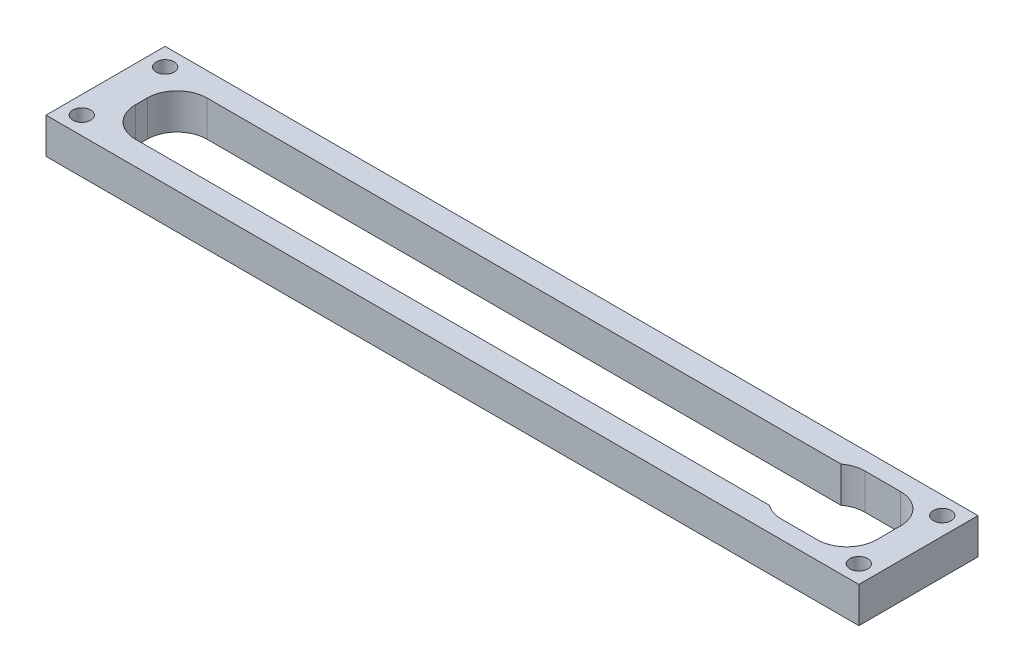
from build123d import *

# Parameters (mm, degrees)
SKETCH1_W           = 136.427821805
SKETCH1_H           = 20
SKETCH1_R           = 1.5
SKETCH1_W_2         = 124.427821805
SKETCH1_H_2         = 12
BOSS_EXTRUDE1_DEPTH = 6
CUT_EXTRUDE1_DEPTH  = 139.01648656
FILLET1_R           = 5


with BuildPart() as part:
    # Sketch1 → Boss-Extrude1 (new body)
    with BuildSketch(Plane(origin=(0, 0, 0), x_dir=(1, 0, 0), z_dir=(0, 1, 0))):
        with Locations((68.213910903, 10)):
            Rectangle(SKETCH1_W, SKETCH1_H)
        with Locations(Location((3, 17, 0), (0, 0, 270))):
            Circle(SKETCH1_R, mode=Mode.SUBTRACT)
        with Locations(Location((3, 3, 0), (0, 0, 90))):
            Circle(SKETCH1_R, mode=Mode.SUBTRACT)
        with Locations(Location((133.427821805, 3, 0), (0, 0, 270))):
            Circle(SKETCH1_R, mode=Mode.SUBTRACT)
        with Locations(Location((133.427821805, 17, 0), (0, 0, 90))):
            Circle(SKETCH1_R, mode=Mode.SUBTRACT)
        with Locations((68.213910903, 10)):
            Rectangle(SKETCH1_W_2, SKETCH1_H_2, mode=Mode.SUBTRACT)
    extrude(amount=BOSS_EXTRUDE1_DEPTH)

    # Sketch2 → Cut-Extrude1 (cut, through all)
    with BuildSketch(Plane(origin=(0, 6, 0), x_dir=(1, 0, 0), z_dir=(0, 1, 0))):
        Polygon((117.427821805, 17), (117.427821805, 16), (130.427821805, 16), (130.427821805, 4), (117.427821805, 4), (117.427821805, 3), (131.427821805, 3), (131.427821805, 17), align=None)
    extrude(amount=-CUT_EXTRUDE1_DEPTH, mode=Mode.SUBTRACT)

    # Fillet1
    # the kernel refuses this fillet: 5 mm, written as the material it adds along each edge
    with BuildSketch(Plane(origin=(131.427821805, 6, -17), x_dir=(0, 0, 1), z_dir=(0, -1, 0)), Plane(origin=(131.427821805, 6, -3), x_dir=(-1, 0, 0), z_dir=(0, -1, 0)), Plane(origin=(6, 0, -16), x_dir=(0, 0, 1), z_dir=(0, 1, 0))) as fillet1_piece_1:
        with BuildLine():
            CenterArc((FILLET1_R, FILLET1_R), FILLET1_R, 180, 90)
            Line((0, FILLET1_R), (-FILLET1_R * 0.02, FILLET1_R))
            Line((-FILLET1_R * 0.02, FILLET1_R), (-FILLET1_R * 0.02, -FILLET1_R * 0.02))
            Line((-FILLET1_R * 0.02, -FILLET1_R * 0.02), (FILLET1_R, -FILLET1_R * 0.02))
            Line((FILLET1_R, -FILLET1_R * 0.02), (FILLET1_R, 0))
        make_face()
    extrude(amount=6)
    with BuildSketch(Plane(origin=(117.427821805, 6, -17), x_dir=(1, 0, 0), z_dir=(0, -1, 0))) as fillet1_piece_2:
        with BuildLine():
            CenterArc((3, 5), FILLET1_R, 233.130102354, 36.869897646)
            Line((0, 1), (-0.06, 0.92))
            ThreePointArc((-0.06, 0.92), (-0.1, 0.5), (-0.1, 0))
            Line((-0.1, 0), (0, -0.1))
            Line((0, -0.1), (3, -0.1))
            Line((3, -0.1), (3, 0))
        make_face()
    extrude(amount=6)
    with BuildSketch(Plane(origin=(117.427821805, 6, -3), x_dir=(0, 0, -1), z_dir=(0, -1, 0))) as fillet1_piece_3:
        with BuildLine():
            CenterArc((5, 3), FILLET1_R, 180, 36.869897646)
            Line((0, 3), (-0.1, 3))
            Line((-0.1, 3), (-0.1, 0))
            Line((-0.1, 0), (0, -0.1))
            ThreePointArc((0, -0.1), (0.5, -0.1), (0.92, -0.06))
            Line((0.92, -0.06), (1, 0))
        make_face()
    extrude(amount=6)
    with BuildSketch(Plane(origin=(6, 0, -4), x_dir=(0, 0, -1), z_dir=(0, 1, 0))) as fillet1_piece_4:
        with BuildLine():
            CenterArc((FILLET1_R, -FILLET1_R), FILLET1_R, 90, 90)
            Line((0, -FILLET1_R), (-FILLET1_R * 0.02, -FILLET1_R))
            Line((-FILLET1_R * 0.02, -FILLET1_R), (-FILLET1_R * 0.02, FILLET1_R * 0.02))
            Line((-FILLET1_R * 0.02, FILLET1_R * 0.02), (FILLET1_R, FILLET1_R * 0.02))
            Line((FILLET1_R, FILLET1_R * 0.02), (FILLET1_R, 0))
        make_face()
    extrude(amount=6)


solid = part.part
